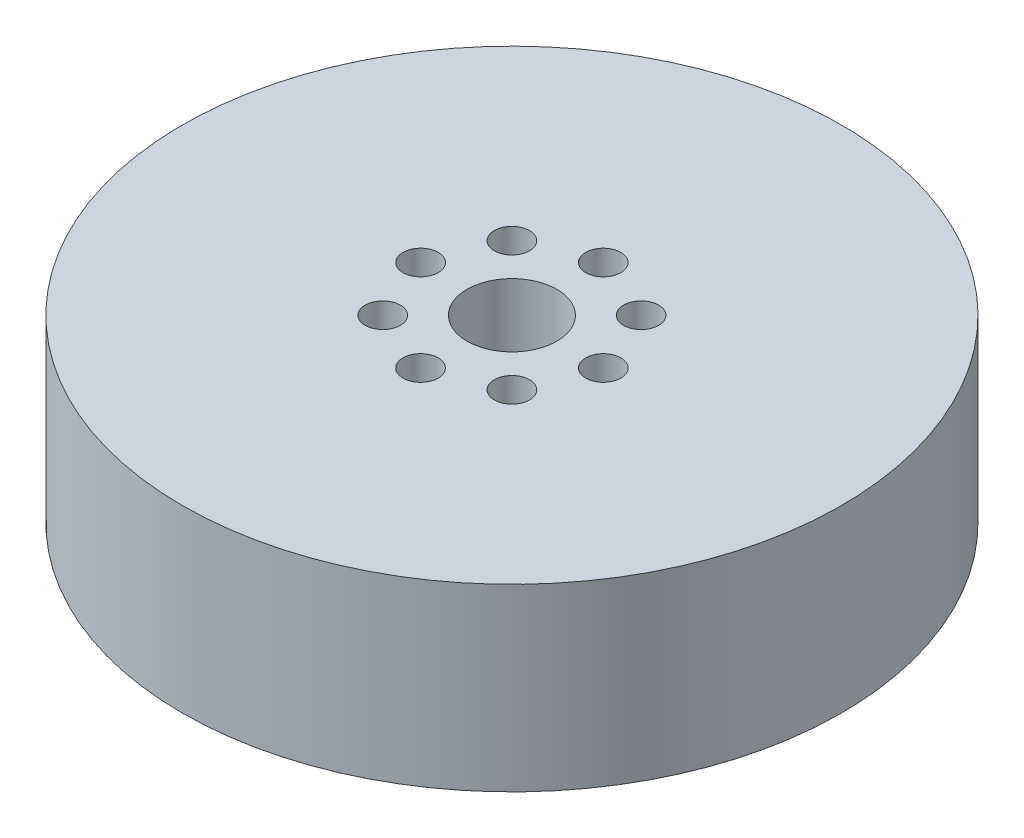
from build123d import *

# Parameters (mm, degrees)
SKETCH1_R           = 55
BOSS_EXTRUDE1_DEPTH = 30
SKETCH2_R           = 7.5
CUT_EXTRUDE1_DEPTH  = 84.366660003
SKETCH3_R           = 2.93393942
CUT_EXTRUDE2_DEPTH  = 23.396981861
CIRPATTERN1_COUNT   = 8


with BuildPart() as part:
    # Sketch1 → Boss-Extrude1 (new body)
    with BuildSketch(Plane(origin=(0, 0, 0), x_dir=(1, 0, 0), z_dir=(0, 1, 0))):
        Circle(SKETCH1_R)
    extrude(amount=BOSS_EXTRUDE1_DEPTH)

    # Sketch2 → Cut-Extrude1 (cut, through all)
    with BuildSketch(Plane(origin=(0, 0, 0), x_dir=(1, 0, 0), z_dir=(0, 1, 0))):
        Circle(SKETCH2_R)
    extrude(amount=CUT_EXTRUDE1_DEPTH, mode=Mode.SUBTRACT)

    # Sketch3 → Cut-Extrude2 (cut)
    with BuildSketch(Plane(origin=(0, 30, 0), x_dir=(1, 0, 0), z_dir=(0, 1, 0))):
        with Locations((-15.242772915, 0)):
            Circle(SKETCH3_R)
    cut_extrude2 = extrude(amount=-CUT_EXTRUDE2_DEPTH, mode=Mode.SUBTRACT)

    # CirPattern1: Cut-Extrude2 ×8 about axis
    cirpattern1_axis = Axis((0, 0, 0), (0, 1, 0))
    for i in range(1, CIRPATTERN1_COUNT):
        add(cut_extrude2.rotate(cirpattern1_axis, i * 360 / CIRPATTERN1_COUNT), mode=Mode.SUBTRACT)


solid = part.part
